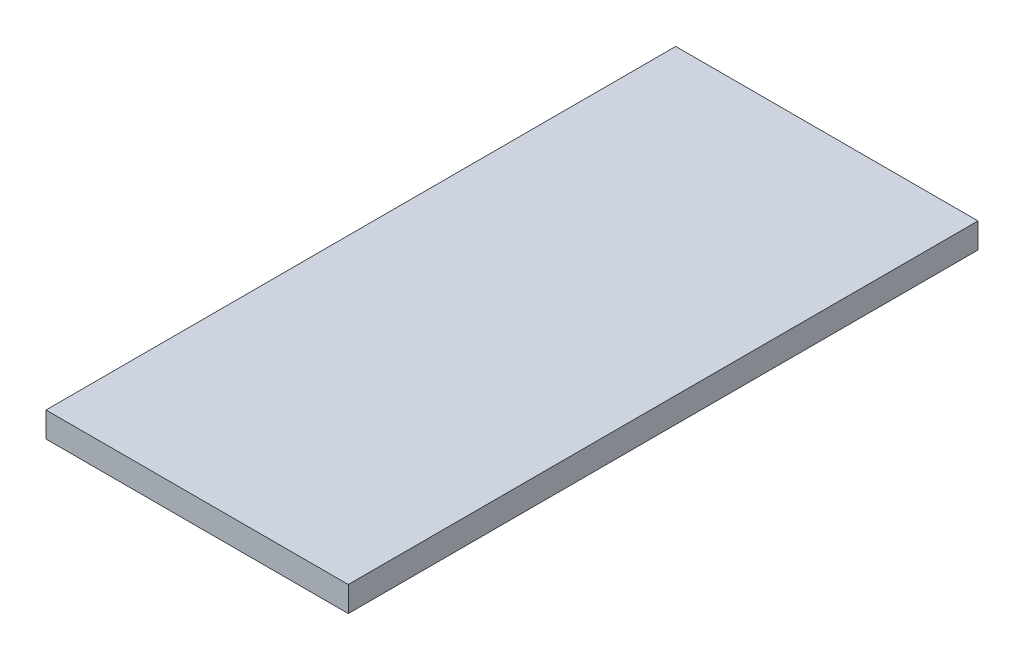
from build123d import *

# Parameters (mm, degrees)
SKETCH_1_W      = 24
SKETCH_1_H      = 50
EXTRUDE_1_DEPTH = 2


with BuildPart() as part:
    # 草图1 → 凸台-拉伸1 (new body)
    with BuildSketch(Plane(origin=(0, 0, 0), x_dir=(1, 0, 0), z_dir=(0, 1, 0))):
        Rectangle(SKETCH_1_W, SKETCH_1_H)
    extrude(amount=EXTRUDE_1_DEPTH)


solid = part.part
